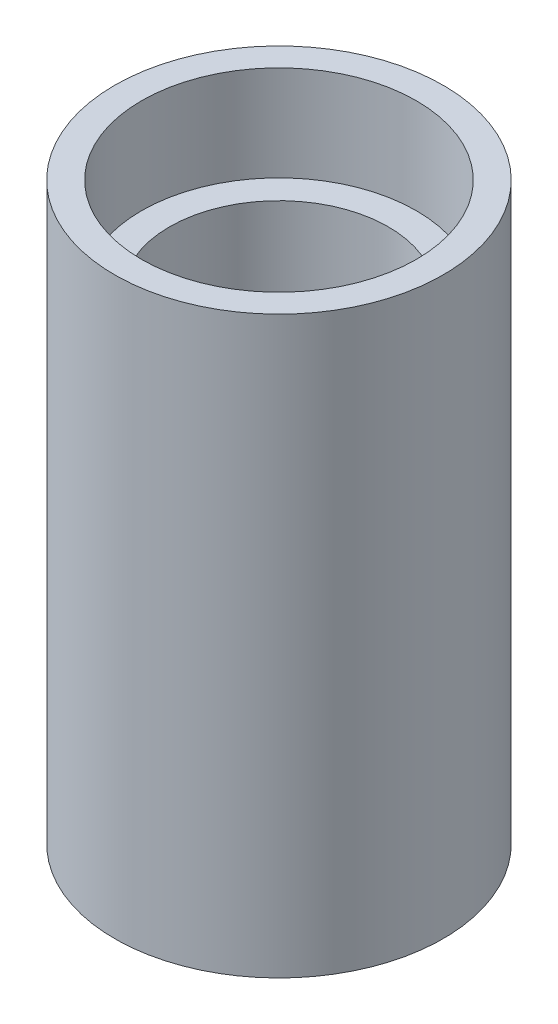
from build123d import *


with BuildPart() as part:
    # Sketch1 → Revolve1 (revolve)
    with BuildSketch(Plane.XY):
        Polygon((25.4, 0), (38.1, 0), (38.1, 133.35), (31.877, 133.35), (31.877, 111.252), (25.4, 111.252), align=None)
    revolve(axis=Axis((0, 55.746772516, 0), (0, -1, 0)))


solid = part.part
